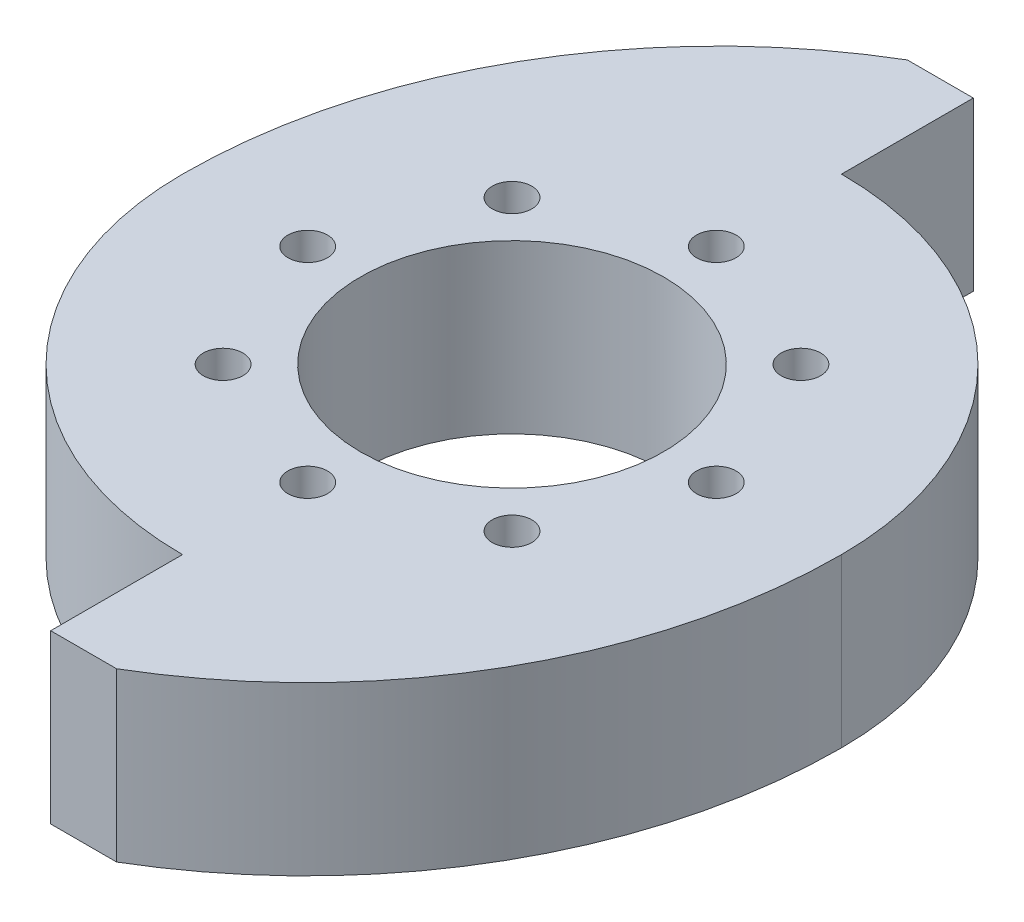
from build123d import *

# Parameters (mm, degrees)
SKETCH1_R           = 1.5
SKETCH1_R_2         = 11.5
BOSS_EXTRUDE1_DEPTH = 6.35


with BuildPart() as part:
    # Sketch1 → Boss-Extrude1 (new, symmetric)
    with BuildSketch(Plane(origin=(0, 0, 0), x_dir=(1, 0, 0), z_dir=(0, 1, 0))):
        with BuildLine():
            ThreePointArc((-5, 35), (-19.647377649, 20.155644371), (-25, 0))
            ThreePointArc((-25, 0), (-17.67766953, -17.67766953), (0, -25))
            Line((0, -25), (0, -35))
            Line((0, -35), (5, -35))
            ThreePointArc((5, -35), (19.647377649, -20.155644371), (25, 0))
            ThreePointArc((25, 0), (17.67766953, 17.67766953), (0, 25))
            Line((0, 25), (0, 35))
            Line((0, 35), (-5, 35))
        make_face()
        with Locations((15.5, 0)):
            Circle(SKETCH1_R, mode=Mode.SUBTRACT)
        with Locations((-10.960155108, -10.960155108)):
            Circle(SKETCH1_R, mode=Mode.SUBTRACT)
        with Locations((0, -15.5)):
            Circle(SKETCH1_R, mode=Mode.SUBTRACT)
        with Locations((10.960155108, -10.960155108)):
            Circle(SKETCH1_R, mode=Mode.SUBTRACT)
        with Locations((-15.5, 0)):
            Circle(SKETCH1_R, mode=Mode.SUBTRACT)
        with Locations((-10.960155108, 10.960155108)):
            Circle(SKETCH1_R, mode=Mode.SUBTRACT)
        Circle(SKETCH1_R_2, mode=Mode.SUBTRACT)
        with Locations((0, 15.5)):
            Circle(SKETCH1_R, mode=Mode.SUBTRACT)
        with Locations((10.960155108, 10.960155108)):
            Circle(SKETCH1_R, mode=Mode.SUBTRACT)
    extrude(amount=BOSS_EXTRUDE1_DEPTH, both=True)


solid = part.part
